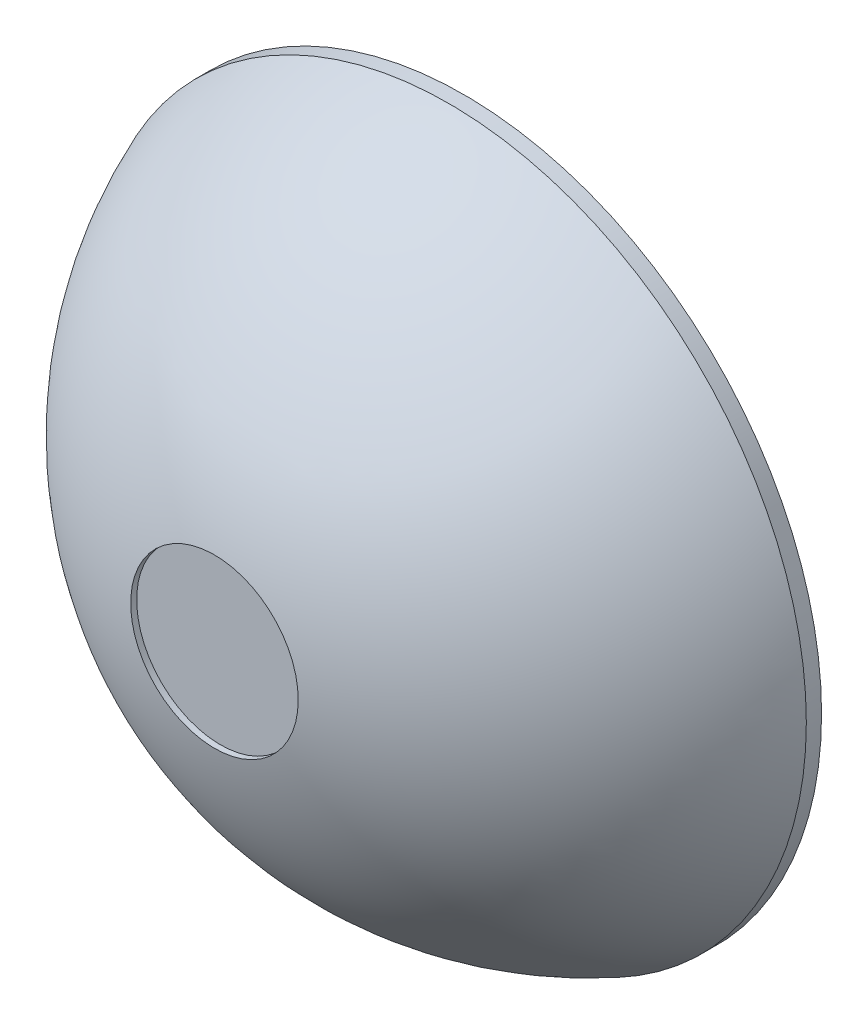
from build123d import *

# Parameters (mm, degrees)
SKETCH3_R           = 17.8816
BOSS_EXTRUDE2_DEPTH = 0.762
DOME1_FACE_RADIUS   = 17.8816
DOME1_HEIGHT        = 12.192
SKETCH4_R           = 4.191
CUT_EXTRUDE1_DEPTH  = 1.016
SKETCH5_R           = 17.3736
CUT_EXTRUDE2_DEPTH  = 1.27


# Read off the part's stored shape, not the designer's step: Shell3
with BuildPart() as part:
    # Sketch3 → Boss-Extrude2 (new body)
    with BuildSketch(Plane.XY):
        with Locations(Location((0, 0, 0), (0, 0, 180))):
            Circle(SKETCH3_R)
    extrude(amount=BOSS_EXTRUDE2_DEPTH)

    # Dome1: a dome of height H over a round flat face of radius A is a cap of a sphere of radius (A * A + H * H) / (2 * H)
    dome1_r = (DOME1_FACE_RADIUS * DOME1_FACE_RADIUS + DOME1_HEIGHT * DOME1_HEIGHT) / (2 * DOME1_HEIGHT)
    dome1_base = Plane((0, 0, 0.762), z_dir=(0, 0, 1))
    with Locations(dome1_base.offset(DOME1_HEIGHT - dome1_r)):
        dome1_ball = Sphere(dome1_r, mode=Mode.PRIVATE)
    add(split(dome1_ball, bisect_by=dome1_base, keep=Keep.TOP, mode=Mode.PRIVATE))

    # Sketch4 → Cut-Extrude1 (cut)
    with BuildSketch(Plane.XY.offset(12.192)):
        Circle(SKETCH4_R)
    extrude(amount=CUT_EXTRUDE1_DEPTH, mode=Mode.SUBTRACT)

    # Sketch5 → Cut-Extrude2 (cut)
    with BuildSketch(Plane(origin=(0, 0, 0), x_dir=(-1, 0, 0), z_dir=(0, 0, -1))):
        Circle(SKETCH5_R)
    extrude(amount=-CUT_EXTRUDE2_DEPTH, mode=Mode.SUBTRACT)

    # Shell3 outline → Shell3 (revolve, cut)
    with BuildSketch(Plane.XZ):
        with BuildLine():
            ThreePointArc((17.120328578, 1.269999983), (12.123689074, 7.983859192), (4.698999991, 11.846022294))
            Line((4.698999991, 11.846022294), (4.699, 11.684))
            Line((4.699, 11.684), (0, 11.684))
            Line((0, 11.684), (0, 1.269999983))
            Line((0, 1.269999983), (17.120328578, 1.269999983))
        make_face()
    revolve(axis=Axis((0, 0, 0), (0, 0, 1)), mode=Mode.SUBTRACT)


solid = part.part
